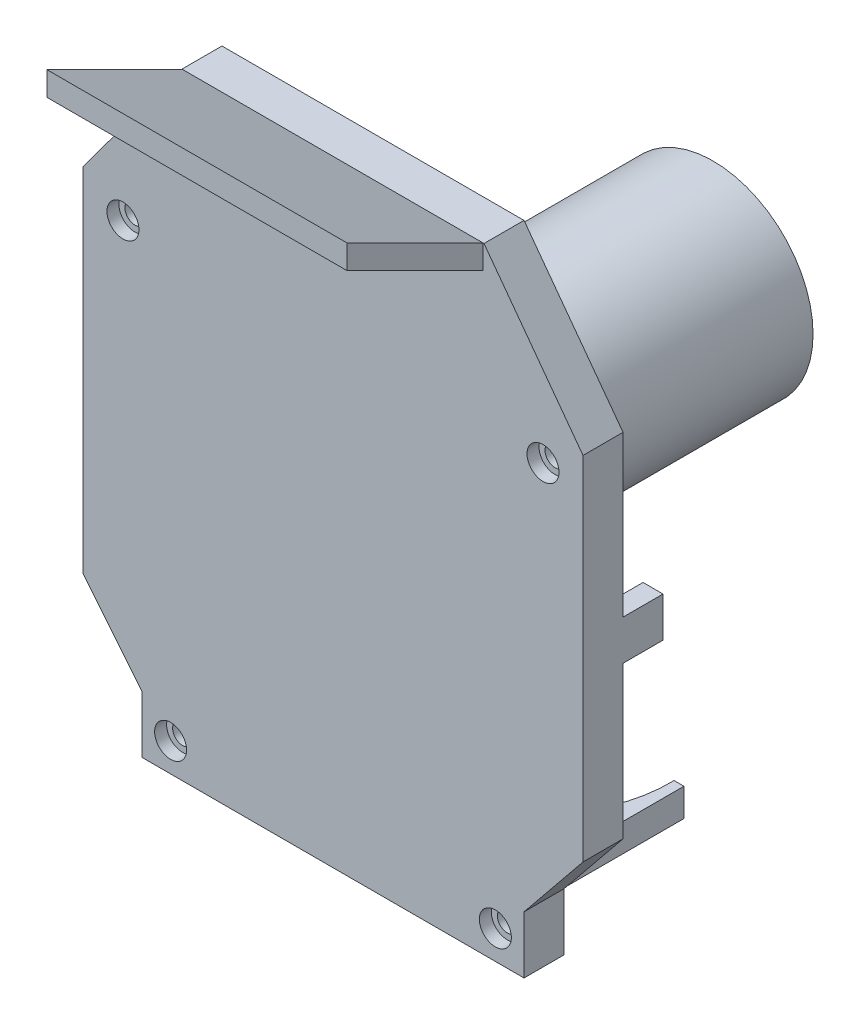
from build123d import *

# Parameters (mm, degrees)
ESTRUSIONE_ESTRUSIONE1_DEPTH       = 30
ESTRUSIONE_ESTRUSIONE1_DEPTH_BACK  = 55
SCHIZZO1_R                         = 25
SCHIZZO1_R_2                       = 20
ESTRUSIONE_ESTRUSIONE2_DEPTH       = 10
ESTRUSIONE_ESTRUSIONE3_DEPTH       = 10
ESTRUSIONE_ESTRUSIONE5_DEPTH       = 42.5
TAGLIO_ESTRUSIONE1_DEPTH           = 26.5
SCHIZZO3D5_R                       = 2.5
TAGLIO_ESTRUSIONE2_DEPTH           = 35.5
SCHIZZO3D6_R                       = 4
TAGLIO_ESTRUSIONE3_DEPTH           = 3
ESTRUSIONE_ESTRUSIONE10_DEPTH      = 5
TAGLIO_ESTRUSIONE4_START           = -14
TAGLIO_ESTRUSIONE4_DEPTH           = 14
TAGLIO_ESTRUSIONE7_DEPTH           = 3
ESTRUSIONE_ESTRUSIONE11_START      = 30
ESTRUSIONE_ESTRUSIONE11_OUTLINE_R  = 4
ESTRUSIONE_ESTRUSIONE11_DEPTH      = 10
ESTRUSIONE_ESTRUSIONE12_DEPTH      = 10
ESTRUSIONE_ESTRUSIONE13_DEPTH      = 10
ESTRUSIONE_ESTRUSIONE14_DEPTH      = 10
TAGLIO_ESTRUSIONE11_DEPTH          = 80
SCHIZZO3D17_R                      = 4
TAGLIO_ESTRUSIONE12_DEPTH          = 3
TAGLIO_ESTRUSIONE13_START          = 30
TAGLIO_ESTRUSIONE13_OUTLINE_R      = 2.5
TAGLIO_ESTRUSIONE13_DEPTH          = 7
ESTRUSIONE_ESTRUSIONE15_DEPTH      = 5
ESTRUSIONE_ESTRUSIONE17_DEPTH      = 37.5
ESTRUSIONE_ESTRUSIONE17_DEPTH_BACK = 37.5


# Read off the part's stored shape, not the designer's step: Estrusione-Estrusione11, Taglio-Estrusione13
with BuildPart() as part:
    # Schizzo1 → Estrusione-Estrusione1 (new, two sides: drawn at the far end of the back side and taken through both)
    with BuildSketch(Plane.XY.offset(-ESTRUSIONE_ESTRUSIONE1_DEPTH_BACK)):
        Circle(SCHIZZO1_R)
        Circle(SCHIZZO1_R_2, mode=Mode.SUBTRACT)
    extrude(amount=ESTRUSIONE_ESTRUSIONE1_DEPTH + ESTRUSIONE_ESTRUSIONE1_DEPTH_BACK)

    # Schizzo3D1 → Estrusione-Estrusione2 (add)
    with BuildSketch(Plane(origin=(-37.75, 73.5, 30), x_dir=(0.4568693936855125, -0.889533786381064, 0), z_dir=(0, 0, -1))):
        Polygon((0, 0), (34.493639223, -67.159800872), (75.600538561, -73.870637396), (146.763241471, -37.321085901), (165.255105821, 0), (130.761466598, 67.159800872), (89.654567261, 73.870637396), (18.49186435, 37.321085901), align=None)
    extrude(amount=-ESTRUSIONE_ESTRUSIONE2_DEPTH)

    # Schizzo3D2 → Estrusione-Estrusione3 (add)
    with BuildSketch(Plane(origin=(62.5, 0, 30), x_dir=(-0.9968152785361251, -0.07974522228289001, 0), z_dir=(0, 0, 1))):
        Polygon((0, 0), (0.797452223, 9.968152785), (5.781528616, 9.569426674), (4.984076393, -0.398726111), align=None)
        Polygon((125.39936204, 0), (120.415285647, 0.398726111), (119.617833424, -9.569426674), (124.601909817, -9.968152785), align=None)
    extrude(amount=-ESTRUSIONE_ESTRUSIONE3_DEPTH)

    # Schizzo3D3 → Estrusione-Estrusione5 (add)
    with BuildSketch(Plane(origin=(35.227450684, -68.5, 30), x_dir=(-0.9974912873801348, -0.0707893466612134, 0), z_dir=(0, 0, 1))):
        Polygon((0, 0), (70.278150268, -4.987456437), (70.632097001, 0), (0.353946733, 4.987456437), align=None)
    extrude(amount=-ESTRUSIONE_ESTRUSIONE5_DEPTH)

    # Schizzo3D4 → Taglio-Estrusione1 (cut)
    with BuildSketch(Plane(origin=(32.75, -68.5, -12.5), x_dir=(-1, 0, 0), z_dir=(0, 1, 0))):
        with BuildLine():
            Line((0, 0), (65.5, 0))
            ThreePointArc((65.5, 0), (32.75, 32.75), (0, 0))
        make_face()
    extrude(amount=-TAGLIO_ESTRUSIONE1_DEPTH, mode=Mode.SUBTRACT)

    # Schizzo3D5 → Taglio-Estrusione2 (cut)
    with BuildSketch(Plane(origin=(-52.5, 33.353317087, 40), x_dir=(0.8440673996564301, -0.5362370975951146, 0), z_dir=(0, 0, -1))):
        with Locations(Location((0, 0, 0), (0, 0, 147.572152721))):
            Circle(SCHIZZO3D5_R)
        with Locations(Location((88.627076964, -56.304895247, 0), (0, 0, 147.572152721))):
            Circle(SCHIZZO3D5_R)
        with Locations(Location((124.397648864, 0, 0), (0, 0, 147.572152721))):
            Circle(SCHIZZO3D5_R)
        with Locations(Location((35.7705719, 56.304895247, 0), (0, 0, 147.572152721))):
            Circle(SCHIZZO3D5_R)
    extrude(amount=TAGLIO_ESTRUSIONE2_DEPTH, mode=Mode.SUBTRACT)

    # Schizzo3D6 → Taglio-Estrusione3 (cut)
    with BuildSketch(Plane(origin=(0, 73.5, 40), x_dir=(0, -1, 0), z_dir=(0, 0, -1))):
        with Locations(Location((40.146682913, 52.5, 0), (0, 0, 270))):
            Circle(SCHIZZO3D6_R)
        with Locations(Location((40.146682913, -52.5, 0), (0, 0, 270))):
            Circle(SCHIZZO3D6_R)
        with Locations(Location((106.853317087, -52.5, 0), (0, 0, 270))):
            Circle(SCHIZZO3D6_R)
        with Locations(Location((106.853317087, 52.5, 0), (0, 0, 270))):
            Circle(SCHIZZO3D6_R)
    extrude(amount=TAGLIO_ESTRUSIONE3_DEPTH, mode=Mode.SUBTRACT)

    # Schizzo3D7 → Estrusione-Estrusione10 (add)
    with BuildSketch(Plane(origin=(35.227450684, -73.5, -12.5), x_dir=(-0.8117651174974726, 0, 0.5839840700004706), z_dir=(0, 1, 0))):
        with BuildLine():
            Line((0, 0), (2.011108045, -1.446791734))
            ThreePointArc((2.011108045, -1.446791734), (47.721893936, 6.013037572), (55.181723242, -39.697748319))
            Line((55.181723242, -39.697748319), (57.192831287, -41.144540052))
            Line((57.192831287, -41.144540052), (82.012154262, -6.644522559))
            Line((82.012154262, -6.644522559), (84.059871804, -8.117651175))
            Line((84.059871804, -8.117651175), (89.899712504, 0))
            Line((89.899712504, 0), (28.611446133, 44.090797285))
            Line((28.611446133, 44.090797285), (22.771605433, 35.97314611))
            Line((22.771605433, 35.97314611), (24.819322975, 34.500017494))
            Line((24.819322975, 34.500017494), (0, 0))
        make_face()
    extrude(amount=-ESTRUSIONE_ESTRUSIONE10_DEPTH)

    # Schizzo3D8 → Taglio-Estrusione4 (cut)
    with BuildSketch(Plane(origin=(0, -78.5, 20.25), x_dir=(-0.707106781186551, 0, -0.7071067811865441), z_dir=(0, -1, 0)).offset(TAGLIO_ESTRUSIONE4_START)):
        with BuildLine():
            ThreePointArc((0, 46.315494168), (-0.707106781, -0.707106781), (46.315494168, 0))
            ThreePointArc((46.315494168, 0), (0, 0), (0, 46.315494168))
        make_face()
    extrude(amount=TAGLIO_ESTRUSIONE4_DEPTH, mode=Mode.SUBTRACT)

    # Schizzo3D9 → Taglio-Estrusione7 (cut)
    with BuildSketch(Plane(origin=(35.227450684, -68.5, -12.5), x_dir=(-0.8562730712113632, 0, 0.5165234046180869), z_dir=(0, -1, 0))):
        with BuildLine():
            Line((0, 0), (2.121374306, 1.279661262))
            ThreePointArc((2.121374306, 1.279661262), (13.749394894, 45.407843828), (58.20726047, 35.111944264))
            Line((58.20726047, 35.111944264), (60.328634776, 36.391605526))
            Line((60.328634776, 36.391605526), (82.280879472, 0))
            Line((82.280879472, 0), (21.952244696, -36.391605526))
            Line((21.952244696, -36.391605526), (0, 0))
        make_face()
    extrude(amount=TAGLIO_ESTRUSIONE7_DEPTH, mode=Mode.SUBTRACT)

    # Estrusione-Estrusione11 outline → Estrusione-Estrusione11 (add)
    with BuildSketch(Plane.XY.offset(ESTRUSIONE_ESTRUSIONE11_START)):
        with Locations((52.5, -33.353317087)):
            Circle(ESTRUSIONE_ESTRUSIONE11_OUTLINE_R)
        with Locations((-52.5, -33.353317087)):
            Circle(ESTRUSIONE_ESTRUSIONE11_OUTLINE_R)
    extrude(amount=ESTRUSIONE_ESTRUSIONE11_DEPTH)

    # Schizzo3D11 → Estrusione-Estrusione12 (add)
    with BuildSketch(Plane(origin=(-62.5, -40, 40), x_dir=(0.9979582700578467, -0.06386932928370219, 0), z_dir=(0, 0, -1))):
        Polygon((0, 0), (0.510954634, 7.98366616), (27.158436361, 36.840627497), (26.839089715, 31.850836147), align=None)
        Polygon((102.504285751, 32.018493137), (102.184939104, 27.028701786), (124.744783757, -7.98366616), (125.255738392, 0), align=None)
    extrude(amount=ESTRUSIONE_ESTRUSIONE12_DEPTH)

    # Schizzo3D12 → Estrusione-Estrusione13 (add)
    with BuildSketch(Plane(origin=(-37.75, -78.5, 40), x_dir=(0.9932296706390209, 0.11616721294023631, 0), z_dir=(0, 0, 1))):
        Polygon((0, 0), (-9.932296706, 1.161672129), (-8.770624577, 11.093968836), (1.161672129, 9.932296706), align=None)
        Polygon((74.988840133, -8.770624577), (84.92113684, -9.932296706), (86.082808969, 0), (76.150512263, 1.161672129), align=None)
    extrude(amount=-ESTRUSIONE_ESTRUSIONE13_DEPTH)

    # Schizzo3D15 → Estrusione-Estrusione14 (add)
    with BuildSketch(Plane(origin=(-49.75, -63.712121212, 40), x_dir=(0.9860632358712049, -0.16637095558783233, 0), z_dir=(0, 0, 1))):
        Polygon((0, 0), (4.627662115, -4.074759177), (2.768690441, -4.388409339), (4.432399997, -14.249041698), (98.601439022, 1.639384561), (96.937729467, 11.500016919), (95.078757792, 11.186366757), (98.113291969, 16.553910081), (100.573565494, 1.972126472), (100.906307405, 0), (2.793015436, -16.553910081), (2.460273525, -14.581783609), align=None)
    extrude(amount=-ESTRUSIONE_ESTRUSIONE14_DEPTH)

    # Schizzo3D16 → Taglio-Estrusione11 (cut)
    with BuildSketch(Plane(origin=(-49.75, -80.5, 40), x_dir=(0.9860632358712049, 0.16637095558783233, 0), z_dir=(0, 0, 1))):
        Polygon((0, 0), (1.972126472, -0.332741911), (4.35509632, 13.790870902), (2.793015436, 16.553910081), align=None)
        Polygon((98.113291969, -16.553910081), (96.141165497, -16.22116817), (98.524135346, -2.097555357), (100.906307405, 0), align=None)
    extrude(amount=-TAGLIO_ESTRUSIONE11_DEPTH, mode=Mode.SUBTRACT)

    # Schizzo3D17 → Taglio-Estrusione12 (cut)
    with BuildSketch(Plane(origin=(0, -80.5, 40), x_dir=(-0.9847878761773714, 0.17376086709631217, 0), z_dir=(0, 0, -1))):
        with Locations(Location((41.215356952, 0, 0), (0, 0, 169.993443701))):
            Circle(SCHIZZO3D17_R)
        with Locations(Location((-38.726539684, 14.10534554, 0), (0, 0, 169.993443701))):
            Circle(SCHIZZO3D17_R)
    extrude(amount=TAGLIO_ESTRUSIONE12_DEPTH, mode=Mode.SUBTRACT)

    # Taglio-Estrusione13 outline → Taglio-Estrusione13 (cut)
    with BuildSketch(Plane.XY.offset(TAGLIO_ESTRUSIONE13_START)):
        with Locations((-40.588383838, -73.338383838)):
            Circle(TAGLIO_ESTRUSIONE13_OUTLINE_R)
        with Locations((40.588383838, -73.338383838)):
            Circle(TAGLIO_ESTRUSIONE13_OUTLINE_R)
    extrude(amount=TAGLIO_ESTRUSIONE13_DEPTH, mode=Mode.SUBTRACT)

    # Schizzo3D19 → Estrusione-Estrusione15 (add)
    with BuildSketch(Plane(origin=(0, 68.5, 30), x_dir=(0.9805806756909201, -0.19611613513818418, 0), z_dir=(0, 0, -1))):
        Polygon((0, 0), (-24.514516892, 4.902903378), (-23.533936217, 9.805806757), (25.495097568, 0), (24.514516892, -4.902903378), align=None)
    extrude(amount=ESTRUSIONE_ESTRUSIONE15_DEPTH)

    # Schizzo3D21 → Estrusione-Estrusione17 (add, two sides: drawn at the far end of the back side and taken through both)
    with BuildSketch(Plane(origin=(0, 73.5, 40), x_dir=(0, 0.4472135954999578, 0.8944271909999159), z_dir=(1, 0, 0)).offset(-ESTRUSIONE_ESTRUSIONE17_DEPTH_BACK)):
        Polygon((0, 0), (38.013155617, 0), (35.329874044, 5.366563146), (-2.683281573, 5.366563146), align=None)
    extrude(amount=ESTRUSIONE_ESTRUSIONE17_DEPTH + ESTRUSIONE_ESTRUSIONE17_DEPTH_BACK)


solid = part.part
